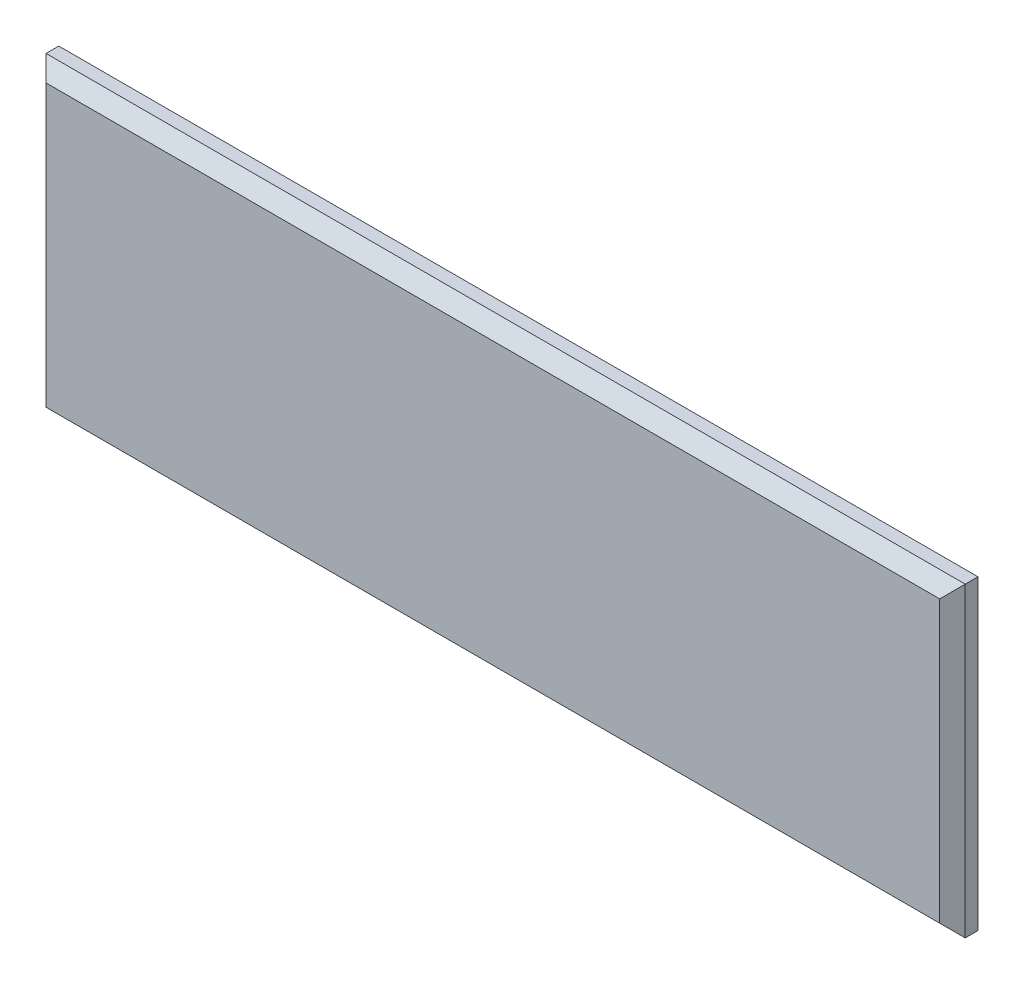
from build123d import *

# Parameters (mm, degrees)
PROFILE_SKETCH_W      = 914.4
PROFILE_SKETCH_H      = 304.8
PROFILE_EXTRUDE_DEPTH = 25.4
EDGE_CHAMFER_SIZE     = 12.7


with BuildPart() as part:
    # Profile Sketch → Profile Extrude (new body)
    with BuildSketch(Plane.XY):
        Rectangle(PROFILE_SKETCH_W, PROFILE_SKETCH_H)
    extrude(amount=PROFILE_EXTRUDE_DEPTH)

    # Edge Chamfer
    edge_chamfer_edges = [part.edges().sort_by_distance(p)[0] for p in [
        (0, -152.4, 25.4),
        (-457.2, 0, 25.4),
        (0, 152.4, 25.4),
        (457.2, 0, 25.4),
    ]]
    chamfer(edge_chamfer_edges, length=EDGE_CHAMFER_SIZE)


solid = part.part
